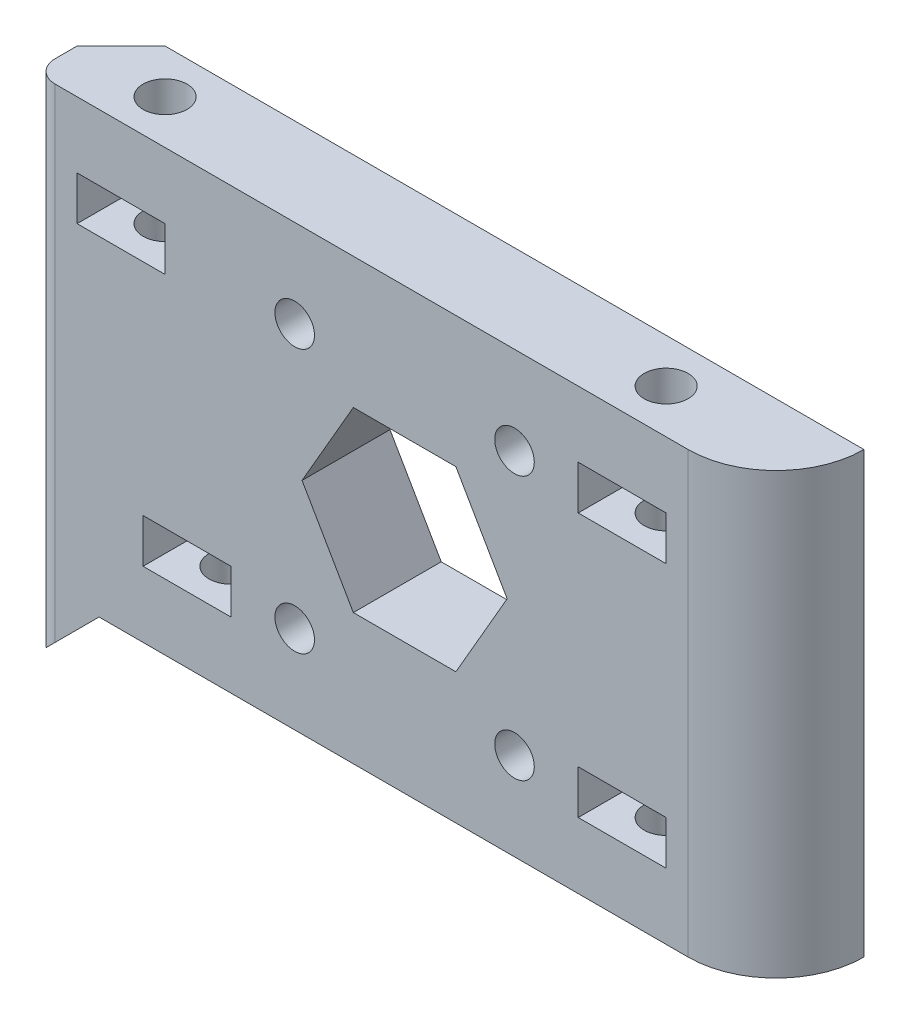
from build123d import *

# Parameters (mm, degrees)
SKETCH1_W           = 4
SKETCH1_H           = 2
SKETCH1_R           = 0.9
BOSS_EXTRUDE1_DEPTH = 4
SKETCH3_R           = 1
CUT_EXTRUDE1_DEPTH  = 20
SKETCH3_3_R         = 1
CUT_EXTRUDE2_DEPTH  = 10
SKETCH5_R           = 1
CUT_EXTRUDE3_DEPTH  = 10
CHAMFER2_SIZE       = 2
FILLET2_R           = 1
FILLET3_R           = 4


with BuildPart() as part:
    # Sketch1 → Boss-Extrude1 (new body)
    # profile 1 of 2: a face of its own
    with BuildSketch(Plane.XY):
        Polygon((-9.335901083, -15.296943817), (-6.335901083, -15.296943817), (24.464098917, -15.296943817), (24.464098917, 4.703056183), (-9.335901083, 4.703056183), align=None)
        with Locations((-2.335901083, -11.296943817)):
            Rectangle(SKETCH1_W, SKETCH1_H, mode=Mode.SUBTRACT)
        with Locations((2.564098917, -11.296943817)):
            Circle(SKETCH1_R, mode=Mode.SUBTRACT)
        with Locations((12.564098917, -11.296943817)):
            Circle(SKETCH1_R, mode=Mode.SUBTRACT)
        with Locations((17.464098917, -11.296943817)):
            Rectangle(SKETCH1_W, SKETCH1_H, mode=Mode.SUBTRACT)
        with Locations((-5.335901083, 0.703056183)):
            Rectangle(SKETCH1_W, SKETCH1_H, mode=Mode.SUBTRACT)
        with Locations((2.564098917, 0.703056183)):
            Circle(SKETCH1_R, mode=Mode.SUBTRACT)
        Polygon((9.896924586, -1.256371234), (12.229750255, -5.296943817), (9.896924586, -9.337516401), (5.231273248, -9.337516401), (2.898447579, -5.296943817), (5.231273248, -1.256371234), align=None, mode=Mode.SUBTRACT)
        with Locations((12.564098917, 0.703056183)):
            Circle(SKETCH1_R, mode=Mode.SUBTRACT)
        with Locations((17.464098917, 0.703056183)):
            Rectangle(SKETCH1_W, SKETCH1_H, mode=Mode.SUBTRACT)
    # profile 2 of 2: a face of its own
    with BuildSketch(Plane.XY):
        Polygon((-9.335901083, -15.296943817), (-9.335901083, -18.296943817), (-6.335901083, -15.296943817), align=None)
    extrude(amount=BOSS_EXTRUDE1_DEPTH)

    # Sketch3 → Cut-Extrude1 (cut)
    with BuildSketch(Plane.XZ.offset(15.296943817)):
        with Locations((17.464098917, 2)):
            Circle(SKETCH3_R)
    extrude(amount=-CUT_EXTRUDE1_DEPTH, mode=Mode.SUBTRACT)

    # Sketch3<3> → Cut-Extrude2 (cut)
    with BuildSketch(Plane.XZ.offset(15.296943817)):
        with Locations((-2.335901083, 2)):
            Circle(SKETCH3_3_R)
    extrude(amount=-CUT_EXTRUDE2_DEPTH, mode=Mode.SUBTRACT)

    # Sketch5 → Cut-Extrude3 (cut)
    with BuildSketch(Plane(origin=(0, 4.703056183, 0), x_dir=(1, 0, 0), z_dir=(0, 1, 0))):
        with Locations(Location((-5.335901083, -2, 0), (0, 0, 180))):
            Circle(SKETCH5_R)
    extrude(amount=-CUT_EXTRUDE3_DEPTH, mode=Mode.SUBTRACT)

    # Chamfer2
    chamfer2_edges = [part.edges().sort_by_distance(p)[0] for p in [
        (-9.335901083, -6.796943817, 0),
    ]]
    chamfer(chamfer2_edges, length=CHAMFER2_SIZE - 0.0001)  # a hair under: the kernel refuses the full size

    # Fillet2
    fillet2_edges = [part.edges().sort_by_distance(p)[0] for p in [
        (-9.335901083, -6.796943817, 4),
    ]]
    fillet(fillet2_edges, radius=FILLET2_R)

    # Fillet3
    fillet3_edges = [part.edges().sort_by_distance(p)[0] for p in [
        (24.464098917, -5.296943817, 4),
    ]]
    fillet(fillet3_edges, radius=FILLET3_R - 0.0001)  # a hair under: the kernel refuses the full size


solid = part.part
